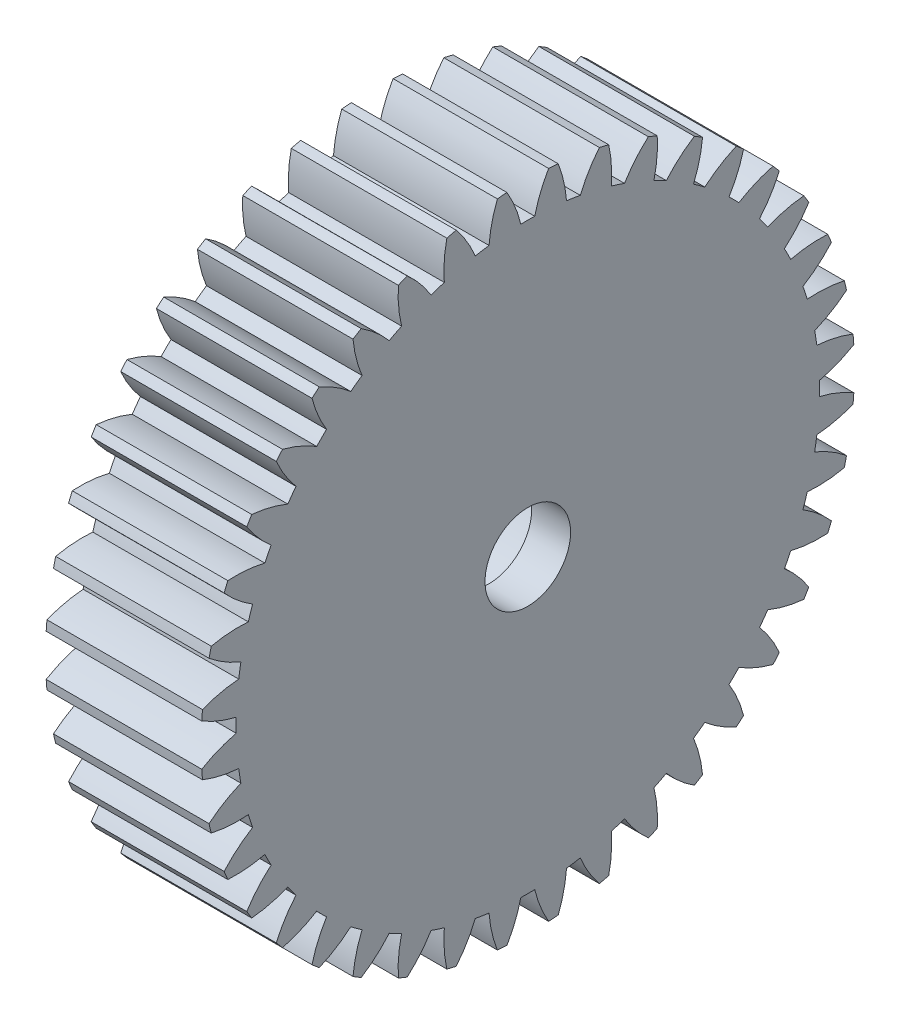
from build123d import *

# Parameters (mm, degrees)
SKETCH1_R           = 0.4
BOSS_EXTRUDE1_DEPTH = 3
SKETCH4_R           = 2.55
CUT_EXTRUDE2_DEPTH  = 13.228899958
BOSS_EXTRUDE2_START = 1
BOSS_EXTRUDE2_DEPTH = 1
SKETCH6_R           = 1.1
CUT_EXTRUDE4_DEPTH  = 13.228899958


with BuildPart() as part:
    # Sketch1 → Boss-Extrude1 (new body)
    with BuildSketch(Plane(origin=(-1.595003587, 0, 0), x_dir=(0, 0, -1), z_dir=(1, 0, 0))):
        with BuildLine():
            ThreePointArc((-8.382899086, 0.535726523), (-7.953265869, 0.324118302), (-7.496863358, 0.178999427))
            ThreePointArc((-7.496863358, 0.178999427), (-7.499, 0), (-7.496863358, -0.178999427))
            ThreePointArc((-7.496863358, -0.178999427), (-7.953265869, -0.324118302), (-8.382899086, -0.535726523))
            ThreePointArc((-8.382899086, -0.535726523), (-8.374105603, -0.659056404), (-8.36349778, -0.782243493))
            ThreePointArc((-8.36349778, -0.782243493), (-7.906051242, -0.924037024), (-7.432566209, -0.995972162))
            ThreePointArc((-7.432566209, -0.995972162), (-7.406674866, -1.173102053), (-7.37656285, -1.349563456))
            ThreePointArc((-7.37656285, -1.349563456), (-7.804644696, -1.564292759), (-8.195885596, -1.840505175))
            ThreePointArc((-8.195885596, -1.840505175), (-8.167907331, -1.960941056), (-8.138159402, -2.080952079))
            ThreePointArc((-8.138159402, -2.080952079), (-7.664163394, -2.149439492), (-7.185254613, -2.146419611))
            ThreePointArc((-7.185254613, -2.146419611), (-7.131972816, -2.317318441), (-7.074626883, -2.486896753))
            ThreePointArc((-7.074626883, -2.486896753), (-7.463847268, -2.765949137), (-7.807062202, -3.099964481))
            ThreePointArc((-7.807062202, -3.099964481), (-7.760588073, -3.214540832), (-7.71243253, -3.328420718))
            ThreePointArc((-7.71243253, -3.328420718), (-7.233558408, -3.321915625), (-6.761018202, -3.244015085))
            ThreePointArc((-6.761018202, -3.244015085), (-6.681657925, -3.404474758), (-6.598490123, -3.562994399))
            ThreePointArc((-6.598490123, -3.562994399), (-6.939265149, -3.899498668), (-7.226003026, -4.283092373))
            ThreePointArc((-7.226003026, -4.283092373), (-7.162177381, -4.388987944), (-7.096799973, -4.493932593))
            ThreePointArc((-7.096799973, -4.493932593), (-6.624839207, -4.412595171), (-6.170303084, -4.261732142))
            ThreePointArc((-6.170303084, -4.261732142), (-6.066818441, -4.407801607), (-5.959876638, -4.551359298))
            ThreePointArc((-5.959876638, -4.551359298), (-6.243815291, -4.9370296), (-6.467015673, -5.360756316))
            ThreePointArc((-6.467015673, -5.360756316), (-6.387410111, -5.455363606), (-6.306420647, -5.548788933))
            ThreePointArc((-6.306420647, -5.548788933), (-5.852994478, -5.39462198), (-5.427654626, -5.174511209))
            ThreePointArc((-5.427654626, -5.174511209), (-5.302593752, -5.302593752), (-5.174511209, -5.427654626))
            ThreePointArc((-5.174511209, -5.427654626), (-5.39462198, -5.852994478), (-5.548788933, -6.306420647))
            ThreePointArc((-5.548788933, -6.306420647), (-5.455363606, -6.387410111), (-5.360756316, -6.467015673))
            ThreePointArc((-5.360756316, -6.467015673), (-4.9370296, -6.243815291), (-4.551359298, -5.959876638))
            ThreePointArc((-4.551359298, -5.959876638), (-4.407801607, -6.066818441), (-4.261732142, -6.170303084))
            ThreePointArc((-4.261732142, -6.170303084), (-4.412595171, -6.624839207), (-4.493932593, -7.096799973))
            ThreePointArc((-4.493932593, -7.096799973), (-4.388987944, -7.162177381), (-4.283092373, -7.226003026))
            ThreePointArc((-4.283092373, -7.226003026), (-3.899498668, -6.939265149), (-3.562994399, -6.598490123))
            ThreePointArc((-3.562994399, -6.598490123), (-3.404474758, -6.681657925), (-3.244015085, -6.761018202))
            ThreePointArc((-3.244015085, -6.761018202), (-3.321915625, -7.233558408), (-3.328420718, -7.71243253))
            ThreePointArc((-3.328420718, -7.71243253), (-3.214540832, -7.760588073), (-3.099964481, -7.807062202))
            ThreePointArc((-3.099964481, -7.807062202), (-2.765949137, -7.463847268), (-2.486896753, -7.074626883))
            ThreePointArc((-2.486896753, -7.074626883), (-2.317318441, -7.131972816), (-2.146419611, -7.185254613))
            ThreePointArc((-2.146419611, -7.185254613), (-2.149439492, -7.664163394), (-2.080952079, -8.138159402))
            ThreePointArc((-2.080952079, -8.138159402), (-1.960941056, -8.167907331), (-1.840505175, -8.195885596))
            ThreePointArc((-1.840505175, -8.195885596), (-1.564292759, -7.804644696), (-1.349563456, -7.37656285))
            ThreePointArc((-1.349563456, -7.37656285), (-1.173102053, -7.406674866), (-0.995972162, -7.432566209))
            ThreePointArc((-0.995972162, -7.432566209), (-0.924037024, -7.906051242), (-0.782243493, -8.36349778))
            ThreePointArc((-0.782243493, -8.36349778), (-0.659056404, -8.374105603), (-0.535726523, -8.382899086))
            ThreePointArc((-0.535726523, -8.382899086), (-0.324118302, -7.953265869), (-0.178999427, -7.496863358))
            ThreePointArc((-0.178999427, -7.496863358), (0, -7.499), (0.178999427, -7.496863358))
            ThreePointArc((0.178999427, -7.496863358), (0.324118302, -7.953265869), (0.535726523, -8.382899086))
            ThreePointArc((0.535726523, -8.382899086), (0.659056404, -8.374105603), (0.782243493, -8.36349778))
            ThreePointArc((0.782243493, -8.36349778), (0.924037024, -7.906051242), (0.995972162, -7.432566209))
            ThreePointArc((0.995972162, -7.432566209), (1.173102053, -7.406674866), (1.349563456, -7.37656285))
            ThreePointArc((1.349563456, -7.37656285), (1.564292759, -7.804644696), (1.840505175, -8.195885596))
            ThreePointArc((1.840505175, -8.195885596), (1.960941056, -8.167907331), (2.080952079, -8.138159402))
            ThreePointArc((2.080952079, -8.138159402), (2.149439492, -7.664163394), (2.146419611, -7.185254613))
            ThreePointArc((2.146419611, -7.185254613), (2.317318441, -7.131972816), (2.486896753, -7.074626883))
            ThreePointArc((2.486896753, -7.074626883), (2.765949137, -7.463847268), (3.099964481, -7.807062202))
            ThreePointArc((3.099964481, -7.807062202), (3.214540832, -7.760588073), (3.328420718, -7.71243253))
            ThreePointArc((3.328420718, -7.71243253), (3.321915625, -7.233558408), (3.244015085, -6.761018202))
            ThreePointArc((3.244015085, -6.761018202), (3.404474758, -6.681657925), (3.562994399, -6.598490123))
            ThreePointArc((3.562994399, -6.598490123), (3.899498668, -6.939265149), (4.283092373, -7.226003026))
            ThreePointArc((4.283092373, -7.226003026), (4.388987944, -7.162177381), (4.493932593, -7.096799973))
            ThreePointArc((4.493932593, -7.096799973), (4.412595171, -6.624839207), (4.261732142, -6.170303084))
            ThreePointArc((4.261732142, -6.170303084), (4.407801607, -6.066818441), (4.551359298, -5.959876638))
            ThreePointArc((4.551359298, -5.959876638), (4.9370296, -6.243815291), (5.360756316, -6.467015673))
            ThreePointArc((5.360756316, -6.467015673), (5.455363606, -6.387410111), (5.548788933, -6.306420647))
            ThreePointArc((5.548788933, -6.306420647), (5.39462198, -5.852994478), (5.174511209, -5.427654626))
            ThreePointArc((5.174511209, -5.427654626), (5.302593752, -5.302593752), (5.427654626, -5.174511209))
            ThreePointArc((5.427654626, -5.174511209), (5.852994478, -5.39462198), (6.306420647, -5.548788933))
            ThreePointArc((6.306420647, -5.548788933), (6.387410111, -5.455363606), (6.467015673, -5.360756316))
            ThreePointArc((6.467015673, -5.360756316), (6.243815291, -4.9370296), (5.959876638, -4.551359298))
            ThreePointArc((5.959876638, -4.551359298), (6.066818441, -4.407801607), (6.170303084, -4.261732142))
            ThreePointArc((6.170303084, -4.261732142), (6.624839207, -4.412595171), (7.096799973, -4.493932593))
            ThreePointArc((7.096799973, -4.493932593), (7.162177381, -4.388987944), (7.226003026, -4.283092373))
            ThreePointArc((7.226003026, -4.283092373), (6.939265149, -3.899498668), (6.598490123, -3.562994399))
            ThreePointArc((6.598490123, -3.562994399), (6.681657925, -3.404474758), (6.761018202, -3.244015085))
            ThreePointArc((6.761018202, -3.244015085), (7.233558408, -3.321915625), (7.71243253, -3.328420718))
            ThreePointArc((7.71243253, -3.328420718), (7.760588073, -3.214540832), (7.807062202, -3.099964481))
            ThreePointArc((7.807062202, -3.099964481), (7.463847268, -2.765949137), (7.074626883, -2.486896753))
            ThreePointArc((7.074626883, -2.486896753), (7.131972816, -2.317318441), (7.185254613, -2.146419611))
            ThreePointArc((7.185254613, -2.146419611), (7.664163394, -2.149439492), (8.138159402, -2.080952079))
            ThreePointArc((8.138159402, -2.080952079), (8.167907331, -1.960941056), (8.195885596, -1.840505175))
            ThreePointArc((8.195885596, -1.840505175), (7.804644696, -1.564292759), (7.37656285, -1.349563456))
            ThreePointArc((7.37656285, -1.349563456), (7.406674866, -1.173102053), (7.432566209, -0.995972162))
            ThreePointArc((7.432566209, -0.995972162), (7.906051242, -0.924037024), (8.36349778, -0.782243493))
            ThreePointArc((8.36349778, -0.782243493), (8.374105603, -0.659056404), (8.382899086, -0.535726523))
            ThreePointArc((8.382899086, -0.535726523), (7.953265869, -0.324118302), (7.496863358, -0.178999427))
            ThreePointArc((7.496863358, -0.178999427), (7.499, 0), (7.496863358, 0.178999427))
            ThreePointArc((7.496863358, 0.178999427), (7.953265869, 0.324118302), (8.382899086, 0.535726523))
            ThreePointArc((8.382899086, 0.535726523), (8.374105603, 0.659056404), (8.36349778, 0.782243493))
            ThreePointArc((8.36349778, 0.782243493), (7.906051242, 0.924037024), (7.432566209, 0.995972162))
            ThreePointArc((7.432566209, 0.995972162), (7.406674866, 1.173102053), (7.37656285, 1.349563456))
            ThreePointArc((7.37656285, 1.349563456), (7.804644696, 1.564292759), (8.195885596, 1.840505175))
            ThreePointArc((8.195885596, 1.840505175), (8.167907331, 1.960941056), (8.138159402, 2.080952079))
            ThreePointArc((8.138159402, 2.080952079), (7.664163394, 2.149439492), (7.185254613, 2.146419611))
            ThreePointArc((7.185254613, 2.146419611), (7.131972816, 2.317318441), (7.074626883, 2.486896753))
            ThreePointArc((7.074626883, 2.486896753), (7.463847268, 2.765949137), (7.807062202, 3.099964481))
            ThreePointArc((7.807062202, 3.099964481), (7.760588073, 3.214540832), (7.71243253, 3.328420718))
            ThreePointArc((7.71243253, 3.328420718), (7.233558408, 3.321915625), (6.761018202, 3.244015085))
            ThreePointArc((6.761018202, 3.244015085), (6.681657925, 3.404474758), (6.598490123, 3.562994399))
            ThreePointArc((6.598490123, 3.562994399), (6.939265149, 3.899498668), (7.226003026, 4.283092373))
            ThreePointArc((7.226003026, 4.283092373), (7.162177381, 4.388987944), (7.096799973, 4.493932593))
            ThreePointArc((7.096799973, 4.493932593), (6.624839207, 4.412595171), (6.170303084, 4.261732142))
            ThreePointArc((6.170303084, 4.261732142), (6.066818441, 4.407801607), (5.959876638, 4.551359298))
            ThreePointArc((5.959876638, 4.551359298), (6.243815291, 4.9370296), (6.467015673, 5.360756316))
            ThreePointArc((6.467015673, 5.360756316), (6.387410111, 5.455363606), (6.306420647, 5.548788933))
            ThreePointArc((6.306420647, 5.548788933), (5.852994478, 5.39462198), (5.427654626, 5.174511209))
            ThreePointArc((5.427654626, 5.174511209), (5.302593752, 5.302593752), (5.174511209, 5.427654626))
            ThreePointArc((5.174511209, 5.427654626), (5.39462198, 5.852994478), (5.548788933, 6.306420647))
            ThreePointArc((5.548788933, 6.306420647), (5.455363606, 6.387410111), (5.360756316, 6.467015673))
            ThreePointArc((5.360756316, 6.467015673), (4.9370296, 6.243815291), (4.551359298, 5.959876638))
            ThreePointArc((4.551359298, 5.959876638), (4.407801607, 6.066818441), (4.261732142, 6.170303084))
            ThreePointArc((4.261732142, 6.170303084), (4.412595171, 6.624839207), (4.493932593, 7.096799973))
            ThreePointArc((4.493932593, 7.096799973), (4.388987944, 7.162177381), (4.283092373, 7.226003026))
            ThreePointArc((4.283092373, 7.226003026), (3.899498668, 6.939265149), (3.562994399, 6.598490123))
            ThreePointArc((3.562994399, 6.598490123), (3.404474758, 6.681657925), (3.244015085, 6.761018202))
            ThreePointArc((3.244015085, 6.761018202), (3.321915625, 7.233558408), (3.328420718, 7.71243253))
            ThreePointArc((3.328420718, 7.71243253), (3.214540832, 7.760588073), (3.099964481, 7.807062202))
            ThreePointArc((3.099964481, 7.807062202), (2.765949137, 7.463847268), (2.486896753, 7.074626883))
            ThreePointArc((2.486896753, 7.074626883), (2.317318441, 7.131972816), (2.146419611, 7.185254613))
            ThreePointArc((2.146419611, 7.185254613), (2.149439492, 7.664163394), (2.080952079, 8.138159402))
            ThreePointArc((2.080952079, 8.138159402), (1.960941056, 8.167907331), (1.840505175, 8.195885596))
            ThreePointArc((1.840505175, 8.195885596), (1.564292759, 7.804644696), (1.349563456, 7.37656285))
            ThreePointArc((1.349563456, 7.37656285), (1.173102053, 7.406674866), (0.995972162, 7.432566209))
            ThreePointArc((0.995972162, 7.432566209), (0.924037024, 7.906051242), (0.782243493, 8.36349778))
            ThreePointArc((0.782243493, 8.36349778), (0.659056404, 8.374105603), (0.535726523, 8.382899086))
            ThreePointArc((0.535726523, 8.382899086), (0.324118302, 7.953265869), (0.178999427, 7.496863358))
            ThreePointArc((0.178999427, 7.496863358), (0, 7.499), (-0.178999427, 7.496863358))
            ThreePointArc((-0.178999427, 7.496863358), (-0.324118302, 7.953265869), (-0.535726523, 8.382899086))
            ThreePointArc((-0.535726523, 8.382899086), (-0.659056404, 8.374105603), (-0.782243493, 8.36349778))
            ThreePointArc((-0.782243493, 8.36349778), (-0.924037024, 7.906051242), (-0.995972162, 7.432566209))
            ThreePointArc((-0.995972162, 7.432566209), (-1.173102053, 7.406674866), (-1.349563456, 7.37656285))
            ThreePointArc((-1.349563456, 7.37656285), (-1.564292759, 7.804644696), (-1.840505175, 8.195885596))
            ThreePointArc((-1.840505175, 8.195885596), (-1.960941056, 8.167907331), (-2.080952079, 8.138159402))
            ThreePointArc((-2.080952079, 8.138159402), (-2.149439492, 7.664163394), (-2.146419611, 7.185254613))
            ThreePointArc((-2.146419611, 7.185254613), (-2.317318441, 7.131972816), (-2.486896753, 7.074626883))
            ThreePointArc((-2.486896753, 7.074626883), (-2.765949137, 7.463847268), (-3.099964481, 7.807062202))
            ThreePointArc((-3.099964481, 7.807062202), (-3.214540832, 7.760588073), (-3.328420718, 7.71243253))
            ThreePointArc((-3.328420718, 7.71243253), (-3.321915625, 7.233558408), (-3.244015085, 6.761018202))
            ThreePointArc((-3.244015085, 6.761018202), (-3.404474758, 6.681657925), (-3.562994399, 6.598490123))
            ThreePointArc((-3.562994399, 6.598490123), (-3.899498668, 6.939265149), (-4.283092373, 7.226003026))
            ThreePointArc((-4.283092373, 7.226003026), (-4.388987944, 7.162177381), (-4.493932593, 7.096799973))
            ThreePointArc((-4.493932593, 7.096799973), (-4.412595171, 6.624839207), (-4.261732142, 6.170303084))
            ThreePointArc((-4.261732142, 6.170303084), (-4.407801607, 6.066818441), (-4.551359298, 5.959876638))
            ThreePointArc((-4.551359298, 5.959876638), (-4.9370296, 6.243815291), (-5.360756316, 6.467015673))
            ThreePointArc((-5.360756316, 6.467015673), (-5.455363606, 6.387410111), (-5.548788933, 6.306420647))
            ThreePointArc((-5.548788933, 6.306420647), (-5.39462198, 5.852994478), (-5.174511209, 5.427654626))
            ThreePointArc((-5.174511209, 5.427654626), (-5.302593752, 5.302593752), (-5.427654626, 5.174511209))
            ThreePointArc((-5.427654626, 5.174511209), (-5.852994478, 5.39462198), (-6.306420647, 5.548788933))
            ThreePointArc((-6.306420647, 5.548788933), (-6.387410111, 5.455363606), (-6.467015673, 5.360756316))
            ThreePointArc((-6.467015673, 5.360756316), (-6.243815291, 4.9370296), (-5.959876638, 4.551359298))
            ThreePointArc((-5.959876638, 4.551359298), (-6.066818441, 4.407801607), (-6.170303084, 4.261732142))
            ThreePointArc((-6.170303084, 4.261732142), (-6.624839207, 4.412595171), (-7.096799973, 4.493932593))
            ThreePointArc((-7.096799973, 4.493932593), (-7.162177381, 4.388987944), (-7.226003026, 4.283092373))
            ThreePointArc((-7.226003026, 4.283092373), (-6.939265149, 3.899498668), (-6.598490123, 3.562994399))
            ThreePointArc((-6.598490123, 3.562994399), (-6.681657925, 3.404474758), (-6.761018202, 3.244015085))
            ThreePointArc((-6.761018202, 3.244015085), (-7.233558408, 3.321915625), (-7.71243253, 3.328420718))
            ThreePointArc((-7.71243253, 3.328420718), (-7.760588073, 3.214540832), (-7.807062202, 3.099964481))
            ThreePointArc((-7.807062202, 3.099964481), (-7.463847268, 2.765949137), (-7.074626883, 2.486896753))
            ThreePointArc((-7.074626883, 2.486896753), (-7.131972816, 2.317318441), (-7.185254613, 2.146419611))
            ThreePointArc((-7.185254613, 2.146419611), (-7.664163394, 2.149439492), (-8.138159402, 2.080952079))
            ThreePointArc((-8.138159402, 2.080952079), (-8.167907331, 1.960941056), (-8.195885596, 1.840505175))
            ThreePointArc((-8.195885596, 1.840505175), (-7.804644696, 1.564292759), (-7.37656285, 1.349563456))
            ThreePointArc((-7.37656285, 1.349563456), (-7.406674866, 1.173102053), (-7.432566209, 0.995972162))
            ThreePointArc((-7.432566209, 0.995972162), (-7.906051242, 0.924037024), (-8.36349778, 0.782243493))
            ThreePointArc((-8.36349778, 0.782243493), (-8.374105603, 0.659056404), (-8.382899086, 0.535726523))
        make_face()
        Circle(SKETCH1_R, mode=Mode.SUBTRACT)
    extrude(amount=-BOSS_EXTRUDE1_DEPTH)

    # Sketch4 → Cut-Extrude2 (cut, through all)
    with BuildSketch(Plane(origin=(-1.595003587, 0, 0), x_dir=(0, 0, -1), z_dir=(1, 0, 0))):
        Circle(SKETCH4_R)
    extrude(amount=-CUT_EXTRUDE2_DEPTH, mode=Mode.SUBTRACT)

    # Sketch5 → Boss-Extrude2 (add)
    with BuildSketch(Plane(origin=(-1.595003587, 0, 0), x_dir=(0, 0, -1), z_dir=(1, 0, 0)).offset(BOSS_EXTRUDE2_START)):
        with BuildLine():
            ThreePointArc((-8.36349778, 0.782243493), (-8.374105603, 0.659056404), (-8.382899086, 0.535726523))
            ThreePointArc((-8.382899086, 0.535726523), (-7.953265869, 0.324118302), (-7.496863358, 0.178999427))
            ThreePointArc((-7.496863358, 0.178999427), (-7.499, 0), (-7.496863358, -0.178999427))
            ThreePointArc((-7.496863358, -0.178999427), (-7.953265869, -0.324118302), (-8.382899086, -0.535726523))
            ThreePointArc((-8.382899086, -0.535726523), (-8.374105603, -0.659056404), (-8.36349778, -0.782243493))
            ThreePointArc((-8.36349778, -0.782243493), (-7.906051242, -0.924037024), (-7.432566209, -0.995972162))
            ThreePointArc((-7.432566209, -0.995972162), (-7.406674866, -1.173102053), (-7.37656285, -1.349563456))
            ThreePointArc((-7.37656285, -1.349563456), (-7.804644696, -1.564292759), (-8.195885596, -1.840505175))
            ThreePointArc((-8.195885596, -1.840505175), (-8.167907331, -1.960941056), (-8.138159402, -2.080952079))
            ThreePointArc((-8.138159402, -2.080952079), (-7.664163394, -2.149439492), (-7.185254613, -2.146419611))
            ThreePointArc((-7.185254613, -2.146419611), (-7.131972816, -2.317318441), (-7.074626883, -2.486896753))
            ThreePointArc((-7.074626883, -2.486896753), (-7.463847268, -2.765949137), (-7.807062202, -3.099964481))
            ThreePointArc((-7.807062202, -3.099964481), (-7.760588073, -3.214540832), (-7.71243253, -3.328420718))
            ThreePointArc((-7.71243253, -3.328420718), (-7.233558408, -3.321915625), (-6.761018202, -3.244015085))
            ThreePointArc((-6.761018202, -3.244015085), (-6.681657925, -3.404474758), (-6.598490123, -3.562994399))
            ThreePointArc((-6.598490123, -3.562994399), (-6.939265149, -3.899498668), (-7.226003026, -4.283092373))
            ThreePointArc((-7.226003026, -4.283092373), (-7.162177381, -4.388987944), (-7.096799973, -4.493932593))
            ThreePointArc((-7.096799973, -4.493932593), (-6.624839207, -4.412595171), (-6.170303084, -4.261732142))
            ThreePointArc((-6.170303084, -4.261732142), (-6.066818441, -4.407801607), (-5.959876638, -4.551359298))
            ThreePointArc((-5.959876638, -4.551359298), (-6.243815291, -4.9370296), (-6.467015673, -5.360756316))
            ThreePointArc((-6.467015673, -5.360756316), (-6.387410111, -5.455363606), (-6.306420647, -5.548788933))
            ThreePointArc((-6.306420647, -5.548788933), (-5.852994478, -5.39462198), (-5.427654626, -5.174511209))
            ThreePointArc((-5.427654626, -5.174511209), (-5.302593752, -5.302593752), (-5.174511209, -5.427654626))
            ThreePointArc((-5.174511209, -5.427654626), (-5.39462198, -5.852994478), (-5.548788933, -6.306420647))
            ThreePointArc((-5.548788933, -6.306420647), (-5.455363606, -6.387410111), (-5.360756316, -6.467015673))
            ThreePointArc((-5.360756316, -6.467015673), (-4.9370296, -6.243815291), (-4.551359298, -5.959876638))
            ThreePointArc((-4.551359298, -5.959876638), (-4.407801607, -6.066818441), (-4.261732142, -6.170303084))
            ThreePointArc((-4.261732142, -6.170303084), (-4.412595171, -6.624839207), (-4.493932593, -7.096799973))
            ThreePointArc((-4.493932593, -7.096799973), (-4.388987944, -7.162177381), (-4.283092373, -7.226003026))
            ThreePointArc((-4.283092373, -7.226003026), (-3.899498668, -6.939265149), (-3.562994399, -6.598490123))
            ThreePointArc((-3.562994399, -6.598490123), (-3.404474758, -6.681657925), (-3.244015085, -6.761018202))
            ThreePointArc((-3.244015085, -6.761018202), (-3.321915625, -7.233558408), (-3.328420718, -7.71243253))
            ThreePointArc((-3.328420718, -7.71243253), (-3.214540832, -7.760588073), (-3.099964481, -7.807062202))
            ThreePointArc((-3.099964481, -7.807062202), (-2.765949137, -7.463847268), (-2.486896753, -7.074626883))
            ThreePointArc((-2.486896753, -7.074626883), (-2.317318441, -7.131972816), (-2.146419611, -7.185254613))
            ThreePointArc((-2.146419611, -7.185254613), (-2.149439492, -7.664163394), (-2.080952079, -8.138159402))
            ThreePointArc((-2.080952079, -8.138159402), (-1.960941056, -8.167907331), (-1.840505175, -8.195885596))
            ThreePointArc((-1.840505175, -8.195885596), (-1.564292759, -7.804644696), (-1.349563456, -7.37656285))
            ThreePointArc((-1.349563456, -7.37656285), (-1.173102053, -7.406674866), (-0.995972162, -7.432566209))
            ThreePointArc((-0.995972162, -7.432566209), (-0.924037024, -7.906051242), (-0.782243493, -8.36349778))
            ThreePointArc((-0.782243493, -8.36349778), (-0.659056404, -8.374105603), (-0.535726523, -8.382899086))
            ThreePointArc((-0.535726523, -8.382899086), (-0.324118302, -7.953265869), (-0.178999427, -7.496863358))
            ThreePointArc((-0.178999427, -7.496863358), (0, -7.499), (0.178999427, -7.496863358))
            ThreePointArc((0.178999427, -7.496863358), (0.324118302, -7.953265869), (0.535726523, -8.382899086))
            ThreePointArc((0.535726523, -8.382899086), (0.659056404, -8.374105603), (0.782243493, -8.36349778))
            ThreePointArc((0.782243493, -8.36349778), (0.924037024, -7.906051242), (0.995972162, -7.432566209))
            ThreePointArc((0.995972162, -7.432566209), (1.173102053, -7.406674866), (1.349563456, -7.37656285))
            ThreePointArc((1.349563456, -7.37656285), (1.564292759, -7.804644696), (1.840505175, -8.195885596))
            ThreePointArc((1.840505175, -8.195885596), (1.960941056, -8.167907331), (2.080952079, -8.138159402))
            ThreePointArc((2.080952079, -8.138159402), (2.149439492, -7.664163394), (2.146419611, -7.185254613))
            ThreePointArc((2.146419611, -7.185254613), (2.317318441, -7.131972816), (2.486896753, -7.074626883))
            ThreePointArc((2.486896753, -7.074626883), (2.765949137, -7.463847268), (3.099964481, -7.807062202))
            ThreePointArc((3.099964481, -7.807062202), (3.214540832, -7.760588073), (3.328420718, -7.71243253))
            ThreePointArc((3.328420718, -7.71243253), (3.321915625, -7.233558408), (3.244015085, -6.761018202))
            ThreePointArc((3.244015085, -6.761018202), (3.404474758, -6.681657925), (3.562994399, -6.598490123))
            ThreePointArc((3.562994399, -6.598490123), (3.899498668, -6.939265149), (4.283092373, -7.226003026))
            ThreePointArc((4.283092373, -7.226003026), (4.388987944, -7.162177381), (4.493932593, -7.096799973))
            ThreePointArc((4.493932593, -7.096799973), (4.412595171, -6.624839207), (4.261732142, -6.170303084))
            ThreePointArc((4.261732142, -6.170303084), (4.407801607, -6.066818441), (4.551359298, -5.959876638))
            ThreePointArc((4.551359298, -5.959876638), (4.9370296, -6.243815291), (5.360756316, -6.467015673))
            ThreePointArc((5.360756316, -6.467015673), (5.455363606, -6.387410111), (5.548788933, -6.306420647))
            ThreePointArc((5.548788933, -6.306420647), (5.39462198, -5.852994478), (5.174511209, -5.427654626))
            ThreePointArc((5.174511209, -5.427654626), (5.302593752, -5.302593752), (5.427654626, -5.174511209))
            ThreePointArc((5.427654626, -5.174511209), (5.852994478, -5.39462198), (6.306420647, -5.548788933))
            ThreePointArc((6.306420647, -5.548788933), (6.387410111, -5.455363606), (6.467015673, -5.360756316))
            ThreePointArc((6.467015673, -5.360756316), (6.243815291, -4.9370296), (5.959876638, -4.551359298))
            ThreePointArc((5.959876638, -4.551359298), (6.066818441, -4.407801607), (6.170303084, -4.261732142))
            ThreePointArc((6.170303084, -4.261732142), (6.624839207, -4.412595171), (7.096799973, -4.493932593))
            ThreePointArc((7.096799973, -4.493932593), (7.162177381, -4.388987944), (7.226003026, -4.283092373))
            ThreePointArc((7.226003026, -4.283092373), (6.939265149, -3.899498668), (6.598490123, -3.562994399))
            ThreePointArc((6.598490123, -3.562994399), (6.681657925, -3.404474758), (6.761018202, -3.244015085))
            ThreePointArc((6.761018202, -3.244015085), (7.233558408, -3.321915625), (7.71243253, -3.328420718))
            ThreePointArc((7.71243253, -3.328420718), (7.760588073, -3.214540832), (7.807062202, -3.099964481))
            ThreePointArc((7.807062202, -3.099964481), (7.463847268, -2.765949137), (7.074626883, -2.486896753))
            ThreePointArc((7.074626883, -2.486896753), (7.131972816, -2.317318441), (7.185254613, -2.146419611))
            ThreePointArc((7.185254613, -2.146419611), (7.664163394, -2.149439492), (8.138159402, -2.080952079))
            ThreePointArc((8.138159402, -2.080952079), (8.167907331, -1.960941056), (8.195885596, -1.840505175))
            ThreePointArc((8.195885596, -1.840505175), (7.804644696, -1.564292759), (7.37656285, -1.349563456))
            ThreePointArc((7.37656285, -1.349563456), (7.406674866, -1.173102053), (7.432566209, -0.995972162))
            ThreePointArc((7.432566209, -0.995972162), (7.906051242, -0.924037024), (8.36349778, -0.782243493))
            ThreePointArc((8.36349778, -0.782243493), (8.374105603, -0.659056404), (8.382899086, -0.535726523))
            ThreePointArc((8.382899086, -0.535726523), (7.953265869, -0.324118302), (7.496863358, -0.178999427))
            ThreePointArc((7.496863358, -0.178999427), (7.499, 0), (7.496863358, 0.178999427))
            ThreePointArc((7.496863358, 0.178999427), (7.953265869, 0.324118302), (8.382899086, 0.535726523))
            ThreePointArc((8.382899086, 0.535726523), (8.374105603, 0.659056404), (8.36349778, 0.782243493))
            ThreePointArc((8.36349778, 0.782243493), (7.906051242, 0.924037024), (7.432566209, 0.995972162))
            ThreePointArc((7.432566209, 0.995972162), (7.406674866, 1.173102053), (7.37656285, 1.349563456))
            ThreePointArc((7.37656285, 1.349563456), (7.804644696, 1.564292759), (8.195885596, 1.840505175))
            ThreePointArc((8.195885596, 1.840505175), (8.167907331, 1.960941056), (8.138159402, 2.080952079))
            ThreePointArc((8.138159402, 2.080952079), (7.664163394, 2.149439492), (7.185254613, 2.146419611))
            ThreePointArc((7.185254613, 2.146419611), (7.131972816, 2.317318441), (7.074626883, 2.486896753))
            ThreePointArc((7.074626883, 2.486896753), (7.463847268, 2.765949137), (7.807062202, 3.099964481))
            ThreePointArc((7.807062202, 3.099964481), (7.760588073, 3.214540832), (7.71243253, 3.328420718))
            ThreePointArc((7.71243253, 3.328420718), (7.233558408, 3.321915625), (6.761018202, 3.244015085))
            ThreePointArc((6.761018202, 3.244015085), (6.681657925, 3.404474758), (6.598490123, 3.562994399))
            ThreePointArc((6.598490123, 3.562994399), (6.939265149, 3.899498668), (7.226003026, 4.283092373))
            ThreePointArc((7.226003026, 4.283092373), (7.162177381, 4.388987944), (7.096799973, 4.493932593))
            ThreePointArc((7.096799973, 4.493932593), (6.624839207, 4.412595171), (6.170303084, 4.261732142))
            ThreePointArc((6.170303084, 4.261732142), (6.066818441, 4.407801607), (5.959876638, 4.551359298))
            ThreePointArc((5.959876638, 4.551359298), (6.243815291, 4.9370296), (6.467015673, 5.360756316))
            ThreePointArc((6.467015673, 5.360756316), (6.387410111, 5.455363606), (6.306420647, 5.548788933))
            ThreePointArc((6.306420647, 5.548788933), (5.852994478, 5.39462198), (5.427654626, 5.174511209))
            ThreePointArc((5.427654626, 5.174511209), (5.302593752, 5.302593752), (5.174511209, 5.427654626))
            ThreePointArc((5.174511209, 5.427654626), (5.39462198, 5.852994478), (5.548788933, 6.306420647))
            ThreePointArc((5.548788933, 6.306420647), (5.455363606, 6.387410111), (5.360756316, 6.467015673))
            ThreePointArc((5.360756316, 6.467015673), (4.9370296, 6.243815291), (4.551359298, 5.959876638))
            ThreePointArc((4.551359298, 5.959876638), (4.407801607, 6.066818441), (4.261732142, 6.170303084))
            ThreePointArc((4.261732142, 6.170303084), (4.412595171, 6.624839207), (4.493932593, 7.096799973))
            ThreePointArc((4.493932593, 7.096799973), (4.388987944, 7.162177381), (4.283092373, 7.226003026))
            ThreePointArc((4.283092373, 7.226003026), (3.899498668, 6.939265149), (3.562994399, 6.598490123))
            ThreePointArc((3.562994399, 6.598490123), (3.404474758, 6.681657925), (3.244015085, 6.761018202))
            ThreePointArc((3.244015085, 6.761018202), (3.321915625, 7.233558408), (3.328420718, 7.71243253))
            ThreePointArc((3.328420718, 7.71243253), (3.214540832, 7.760588073), (3.099964481, 7.807062202))
            ThreePointArc((3.099964481, 7.807062202), (2.765949137, 7.463847268), (2.486896753, 7.074626883))
            ThreePointArc((2.486896753, 7.074626883), (2.317318441, 7.131972816), (2.146419611, 7.185254613))
            ThreePointArc((2.146419611, 7.185254613), (2.149439492, 7.664163394), (2.080952079, 8.138159402))
            ThreePointArc((2.080952079, 8.138159402), (1.960941056, 8.167907331), (1.840505175, 8.195885596))
            ThreePointArc((1.840505175, 8.195885596), (1.564292759, 7.804644696), (1.349563456, 7.37656285))
            ThreePointArc((1.349563456, 7.37656285), (1.173102053, 7.406674866), (0.995972162, 7.432566209))
            ThreePointArc((0.995972162, 7.432566209), (0.924037024, 7.906051242), (0.782243493, 8.36349778))
            ThreePointArc((0.782243493, 8.36349778), (0.659056404, 8.374105603), (0.535726523, 8.382899086))
            ThreePointArc((0.535726523, 8.382899086), (0.324118302, 7.953265869), (0.178999427, 7.496863358))
            ThreePointArc((0.178999427, 7.496863358), (0, 7.499), (-0.178999427, 7.496863358))
            ThreePointArc((-0.178999427, 7.496863358), (-0.324118302, 7.953265869), (-0.535726523, 8.382899086))
            ThreePointArc((-0.535726523, 8.382899086), (-0.659056404, 8.374105603), (-0.782243493, 8.36349778))
            ThreePointArc((-0.782243493, 8.36349778), (-0.924037024, 7.906051242), (-0.995972162, 7.432566209))
            ThreePointArc((-0.995972162, 7.432566209), (-1.173102053, 7.406674866), (-1.349563456, 7.37656285))
            ThreePointArc((-1.349563456, 7.37656285), (-1.564292759, 7.804644696), (-1.840505175, 8.195885596))
            ThreePointArc((-1.840505175, 8.195885596), (-1.960941056, 8.167907331), (-2.080952079, 8.138159402))
            ThreePointArc((-2.080952079, 8.138159402), (-2.149439492, 7.664163394), (-2.146419611, 7.185254613))
            ThreePointArc((-2.146419611, 7.185254613), (-2.317318441, 7.131972816), (-2.486896753, 7.074626883))
            ThreePointArc((-2.486896753, 7.074626883), (-2.765949137, 7.463847268), (-3.099964481, 7.807062202))
            ThreePointArc((-3.099964481, 7.807062202), (-3.214540832, 7.760588073), (-3.328420718, 7.71243253))
            ThreePointArc((-3.328420718, 7.71243253), (-3.321915625, 7.233558408), (-3.244015085, 6.761018202))
            ThreePointArc((-3.244015085, 6.761018202), (-3.404474758, 6.681657925), (-3.562994399, 6.598490123))
            ThreePointArc((-3.562994399, 6.598490123), (-3.899498668, 6.939265149), (-4.283092373, 7.226003026))
            ThreePointArc((-4.283092373, 7.226003026), (-4.388987944, 7.162177381), (-4.493932593, 7.096799973))
            ThreePointArc((-4.493932593, 7.096799973), (-4.412595171, 6.624839207), (-4.261732142, 6.170303084))
            ThreePointArc((-4.261732142, 6.170303084), (-4.407801607, 6.066818441), (-4.551359298, 5.959876638))
            ThreePointArc((-4.551359298, 5.959876638), (-4.9370296, 6.243815291), (-5.360756316, 6.467015673))
            ThreePointArc((-5.360756316, 6.467015673), (-5.455363606, 6.387410111), (-5.548788933, 6.306420647))
            ThreePointArc((-5.548788933, 6.306420647), (-5.39462198, 5.852994478), (-5.174511209, 5.427654626))
            ThreePointArc((-5.174511209, 5.427654626), (-5.302593752, 5.302593752), (-5.427654626, 5.174511209))
            ThreePointArc((-5.427654626, 5.174511209), (-5.852994478, 5.39462198), (-6.306420647, 5.548788933))
            ThreePointArc((-6.306420647, 5.548788933), (-6.387410111, 5.455363606), (-6.467015673, 5.360756316))
            ThreePointArc((-6.467015673, 5.360756316), (-6.243815291, 4.9370296), (-5.959876638, 4.551359298))
            ThreePointArc((-5.959876638, 4.551359298), (-6.066818441, 4.407801607), (-6.170303084, 4.261732142))
            ThreePointArc((-6.170303084, 4.261732142), (-6.624839207, 4.412595171), (-7.096799973, 4.493932593))
            ThreePointArc((-7.096799973, 4.493932593), (-7.162177381, 4.388987944), (-7.226003026, 4.283092373))
            ThreePointArc((-7.226003026, 4.283092373), (-6.939265149, 3.899498668), (-6.598490123, 3.562994399))
            ThreePointArc((-6.598490123, 3.562994399), (-6.681657925, 3.404474758), (-6.761018202, 3.244015085))
            ThreePointArc((-6.761018202, 3.244015085), (-7.233558408, 3.321915625), (-7.71243253, 3.328420718))
            ThreePointArc((-7.71243253, 3.328420718), (-7.760588073, 3.214540832), (-7.807062202, 3.099964481))
            ThreePointArc((-7.807062202, 3.099964481), (-7.463847268, 2.765949137), (-7.074626883, 2.486896753))
            ThreePointArc((-7.074626883, 2.486896753), (-7.131972816, 2.317318441), (-7.185254613, 2.146419611))
            ThreePointArc((-7.185254613, 2.146419611), (-7.664163394, 2.149439492), (-8.138159402, 2.080952079))
            ThreePointArc((-8.138159402, 2.080952079), (-8.167907331, 1.960941056), (-8.195885596, 1.840505175))
            ThreePointArc((-8.195885596, 1.840505175), (-7.804644696, 1.564292759), (-7.37656285, 1.349563456))
            ThreePointArc((-7.37656285, 1.349563456), (-7.406674866, 1.173102053), (-7.432566209, 0.995972162))
            ThreePointArc((-7.432566209, 0.995972162), (-7.906051242, 0.924037024), (-8.36349778, 0.782243493))
        make_face()
    extrude(amount=-BOSS_EXTRUDE2_DEPTH)

    # Sketch6 → Cut-Extrude4 (cut, through all)
    with BuildSketch(Plane(origin=(-1.595003587, 0, 0), x_dir=(0, 0, -1), z_dir=(1, 0, 0))):
        Circle(SKETCH6_R)
    extrude(amount=CUT_EXTRUDE4_DEPTH, mode=Mode.SUBTRACT)


solid = part.part
